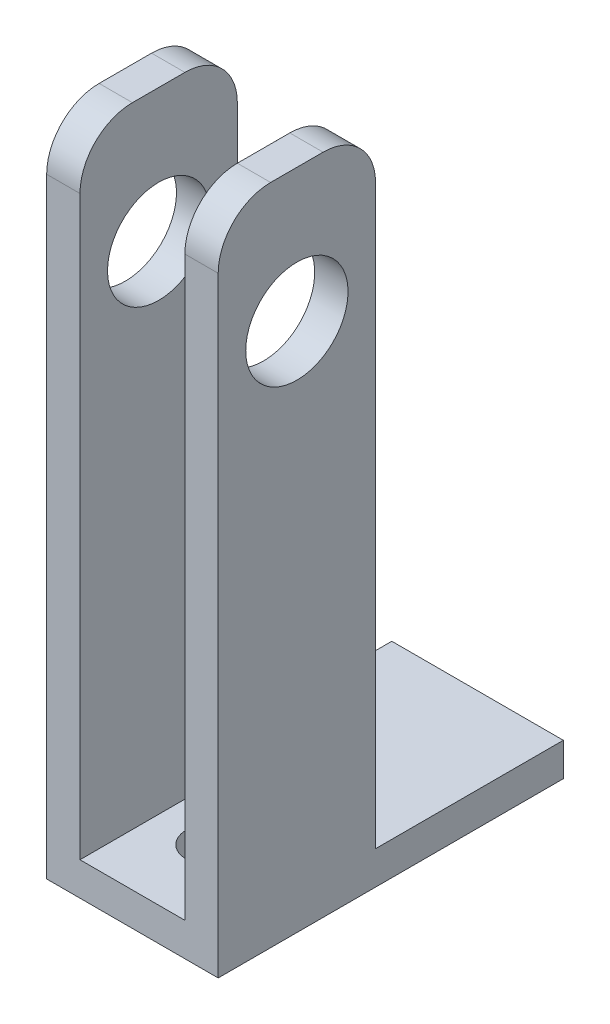
from build123d import *

# Parameters (mm, degrees)
SKETCH1_R                = 10
BOSS_EXTRUDE1_DEPTH      = 6.35
SKETCH5_W                = 20
SKETCH5_H                = 30
BOSS_EXTRUDE2_DEPTH      = 6.35
BOSS_EXTRUDE3_DEPTH      = 120
BOSS_EXTRUDE3_DEPTH_BACK = 6.35
SKETCH7_W                = 6.35
SKETCH7_H                = 30
SKETCH8_R                = 9.75
CUT_EXTRUDE2_DEPTH       = 132.372038501
SKETCH2_R                = 4.7625
CUT_EXTRUDE1_DEPTH       = 123.03410384
FILLET2_R                = 10
SKETCH11_W               = 32.7
SKETCH11_H               = 35.8
BOSS_EXTRUDE5_DEPTH      = 6.35


with BuildPart() as part:
    # Sketch1 → Boss-Extrude1 (new body)
    with BuildSketch(Plane(origin=(0, 0, 0), x_dir=(1, 0, 0), z_dir=(0, 1, 0))):
        Circle(SKETCH1_R)
    extrude(amount=BOSS_EXTRUDE1_DEPTH)

    # Sketch5 → Boss-Extrude2 (add)
    with BuildSketch(Plane(origin=(0, 6.35, 0), x_dir=(1, 0, 0), z_dir=(0, 1, 0))):
        Rectangle(SKETCH5_W, SKETCH5_H)
    extrude(amount=-BOSS_EXTRUDE2_DEPTH)

    # Sketch7 → Boss-Extrude3 (add, two sides: drawn at the far end of the back side and taken through both)
    with BuildSketch(Plane(origin=(0, 6.35, 0), x_dir=(1, 0, 0), z_dir=(0, 1, 0)).offset(-BOSS_EXTRUDE3_DEPTH_BACK)):
        with Locations((-13.175, 0)):
            Rectangle(SKETCH7_W, SKETCH7_H)
        with Locations((13.175, 0)):
            Rectangle(SKETCH7_W, SKETCH7_H)
    extrude(amount=BOSS_EXTRUDE3_DEPTH + BOSS_EXTRUDE3_DEPTH_BACK)

    # Sketch8 → Cut-Extrude2 (cut, through all)
    with BuildSketch(Plane.ZY.offset(16.35)):
        with Locations((0, 100.95)):
            Circle(SKETCH8_R)
    extrude(amount=-CUT_EXTRUDE2_DEPTH, mode=Mode.SUBTRACT)

    # Sketch2 → Cut-Extrude1 (cut, through all)
    with BuildSketch(Plane(origin=(0, 6.35, 0), x_dir=(1, 0, 0), z_dir=(0, 1, 0))):
        Circle(SKETCH2_R)
    extrude(amount=-CUT_EXTRUDE1_DEPTH, mode=Mode.SUBTRACT)

    # Fillet2
    fillet2_edges = [part.edges().sort_by_distance(p)[0] for p in [
        (13.175, 126.35, -15),
        (-13.175, 126.35, 15),
        (13.175, 126.35, 15),
        (-13.175, 126.35, -15),
    ]]
    fillet(fillet2_edges, radius=FILLET2_R)

    # Sketch11 → Boss-Extrude5 (add)
    with BuildSketch(Plane.XZ):
        with Locations((0, -32.9)):
            Rectangle(SKETCH11_W, SKETCH11_H)
    extrude(amount=-BOSS_EXTRUDE5_DEPTH)


solid = part.part
